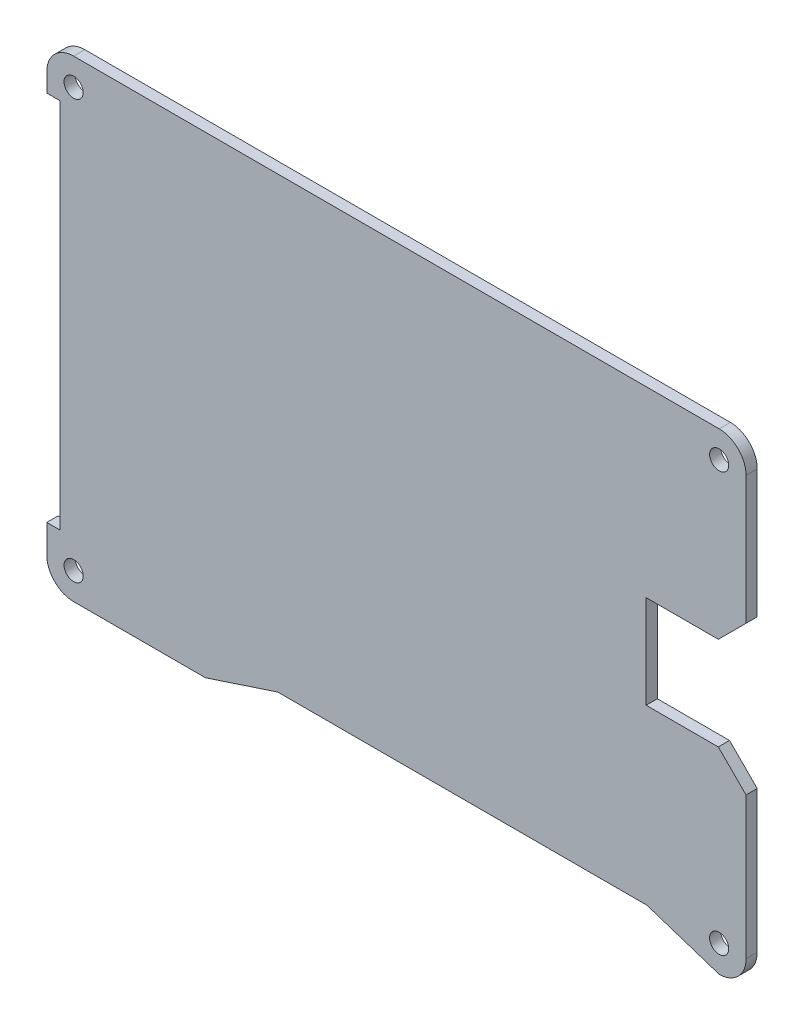
from build123d import *

# Parameters (mm, degrees)
SKETCH1_R           = 1.355900406
BOSS_EXTRUDE1_DEPTH = 1.5875


with BuildPart() as part:
    # Sketch1 → Boss-Extrude1 (new body)
    with BuildSketch(Plane.XY):
        with BuildLine():
            Line((-301.9473, 111.74645), (-305.87795, 115.6771))
            Line((-305.87795, 115.6771), (-316.1078, 115.6771))
            Line((-316.1078, 115.6771), (-316.1078, 128.8851))
            Line((-316.1078, 128.8851), (-305.87795, 128.8851))
            Line((-305.87795, 128.8851), (-301.9473, 132.81575))
            Line((-301.9473, 132.81575), (-301.9473, 150.9704))
            ThreePointArc((-301.9473, 150.9704), (-303.063223164, 153.664476836), (-305.7573, 154.7804))
            Line((-305.7573, 154.7804), (-397.247125, 154.7804))
            ThreePointArc((-397.247125, 154.7804), (-399.946077222, 153.659592612), (-401.0571, 150.956597849))
            Line((-401.0571, 150.956597849), (-401.0571, 148.341))
            Line((-401.0571, 148.341), (-399.1521, 148.341))
            Line((-399.1521, 148.341), (-399.1521, 95.6449))
            Line((-399.1521, 95.6449), (-401.0571, 95.6449))
            Line((-401.0571, 95.6449), (-401.0571, 91.659304166))
            ThreePointArc((-401.0571, 91.659304166), (-399.951018769, 88.947400452), (-397.2472, 87.8217))
            Line((-397.2472, 87.8217), (-378.5565, 87.8217))
            Line((-378.5565, 87.8217), (-368.3165, 91.1883))
            Line((-368.3165, 91.1883), (-315.9973, 91.1883))
            Line((-315.9973, 91.1883), (-305.7573, 87.8217))
            ThreePointArc((-305.7573, 87.8217), (-303.063223164, 88.937623164), (-301.9473, 91.6317))
            Line((-301.9473, 91.6317), (-301.9473, 111.74645))
        make_face()
        with Locations((-305.7573, 91.6317)):
            Circle(SKETCH1_R, mode=Mode.SUBTRACT)
        with Locations((-305.7573, 150.9704)):
            Circle(SKETCH1_R, mode=Mode.SUBTRACT)
        with Locations((-397.247125, 150.9704)):
            Circle(SKETCH1_R, mode=Mode.SUBTRACT)
        with Locations((-397.2472, 91.6317)):
            Circle(SKETCH1_R, mode=Mode.SUBTRACT)
    extrude(amount=BOSS_EXTRUDE1_DEPTH)


solid = part.part
